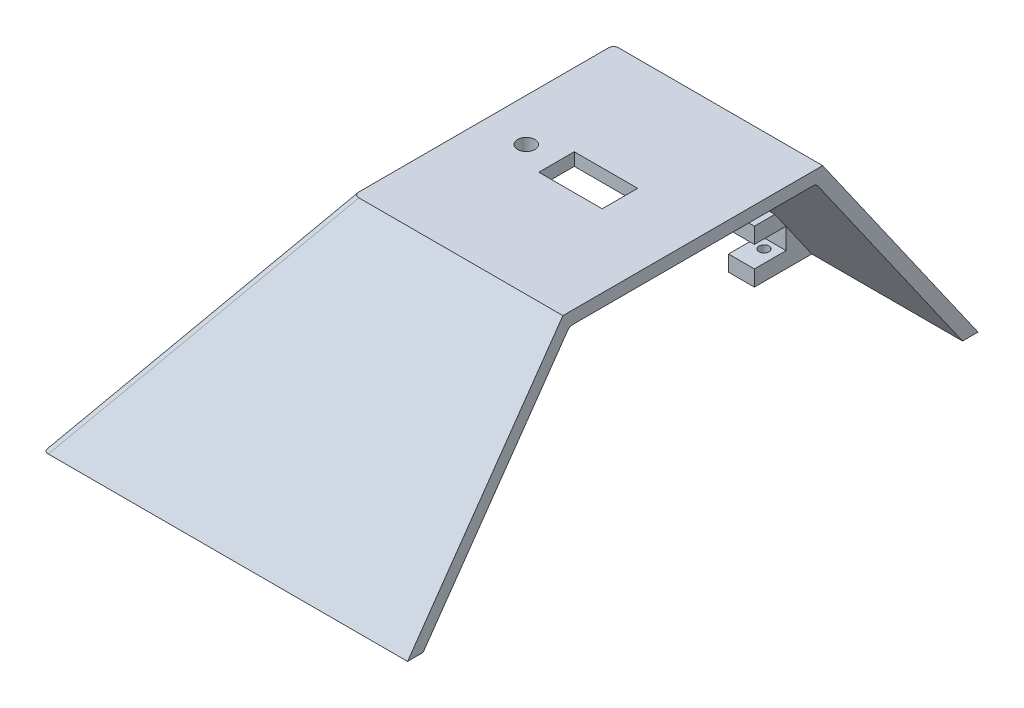
from build123d import *

# Parameters (mm, degrees)
CROQUIS1_W                        = 180
CROQUIS1_H                        = 180
SALIENTE_EXTRUIR1_DEPTH           = 70
CORTAR_EXTRUIR2_REACH             = 215.073
CORTAR_EXTRUIR1_REACH             = 215.073
VACIADO1_T                        = -4
CORTAR_EXTRUIR3_REACH             = 182.293
CORTAR_EXTRUIR5_REACH             = 147.258
CORTAR_EXTRUIR5_DIRECTION_2_REACH = 147.258
SALIENTE_EXTRUIR2_REACH           = 196.034
CROQUIS9_W                        = 8.169588688
CROQUIS9_H                        = 16.665225582
CROQUIS10_W                       = 8.169588688
CROQUIS10_H                       = 6.685330319
CORTAR_EXTRUIR6_DEPTH             = 10
CORTAR_EXTRUIR7_REACH             = 147.258
CROQUIS11_R                       = 1.585
CORTAR_EXTRUIR8_REACH             = 147.258
CROQUIS12_W                       = 20
CROQUIS12_H                       = 11.2
REDONDEO1_R                       = 2
CORTAR_EXTRUIR9_REACH             = 147.258
CROQUIS13_R                       = 2.75


with BuildPart() as part:
    # Croquis1 → Saliente-Extruir1 (new body)
    with BuildSketch(Plane(origin=(0, 0, 0), x_dir=(1, 0, 0), z_dir=(0, 1, 0))):
        Rectangle(CROQUIS1_W, CROQUIS1_H)
    extrude(amount=SALIENTE_EXTRUIR1_DEPTH)

    # Croquis3 → Cortar-Extruir2 (cut, up to next)
    with BuildSketch(Plane.ZY.offset(90), mode=Mode.PRIVATE) as cortar_extruir2_sk1:
        Polygon((-90, 0), (-90, 70), (-40.985472325, 70), align=None)
    cortar_extruir2_tool1 = extrude(cortar_extruir2_sk1.sketch, amount=-CORTAR_EXTRUIR2_REACH, mode=Mode.PRIVATE) & part.part
    # Croquis3 → Cortar-Extruir2 (cut, up to next)
    with BuildSketch(Plane.ZY.offset(90), mode=Mode.PRIVATE) as cortar_extruir2_sk2:
        Polygon((90, 0), (90, 70), (40.985472325, 70), align=None)
    cortar_extruir2_tool2 = extrude(cortar_extruir2_sk2.sketch, amount=-CORTAR_EXTRUIR2_REACH, mode=Mode.PRIVATE) & part.part
    add(cortar_extruir2_tool1.solids().sort_by_distance((-90, 46.666667, -73.661824))[0], mode=Mode.SUBTRACT)
    add(cortar_extruir2_tool2.solids().sort_by_distance((-90, 46.666667, 73.661824))[0], mode=Mode.SUBTRACT)

    # Croquis2 → Cortar-Extruir1 (cut, up to next)
    with BuildSketch(Plane.XY.offset(90), mode=Mode.PRIVATE) as cortar_extruir1_sk1:
        Polygon((90, 0), (90, 80), (33.983396943, 80), align=None)
    cortar_extruir1_tool1 = extrude(cortar_extruir1_sk1.sketch, amount=-CORTAR_EXTRUIR1_REACH, mode=Mode.PRIVATE) & part.part
    # Croquis2 → Cortar-Extruir1 (cut, up to next)
    with BuildSketch(Plane.XY.offset(90), mode=Mode.PRIVATE) as cortar_extruir1_sk2:
        Polygon((-90, 80), (-33.983396943, 80), (-90, 0), align=None)
    cortar_extruir1_tool2 = extrude(cortar_extruir1_sk2.sketch, amount=-CORTAR_EXTRUIR1_REACH, mode=Mode.PRIVATE) & part.part
    add(cortar_extruir1_tool1.solids().sort_by_distance((71.327799, 53.333333, 90))[0], mode=Mode.SUBTRACT)
    add(cortar_extruir1_tool2.solids().sort_by_distance((-71.327799, 53.333333, 90))[0], mode=Mode.SUBTRACT)

    # Vaciado1
    vaciado1_openings = [part.faces().sort_by_distance(p)[0] for p in [
        (0, 0, 0),
    ]]
    offset(amount=VACIADO1_T, openings=vaciado1_openings, kind=Kind.INTERSECTION)

    # Croquis4 → Cortar-Extruir3 (cut, up to next)
    with BuildSketch(Plane(origin=(60.39090645, 42.286167935, 0), x_dir=(0, 0, -1), z_dir=(0.819152044288995, 0.5735764363510417, 0)), mode=Mode.PRIVATE) as cortar_extruir3_sk1:
        Polygon((-90, -51.621879272), (-40.985472325, 33.832341942), (40.985472325, 33.832341942), (90, -51.621879272), align=None)
    cortar_extruir3_tool1 = extrude(cortar_extruir3_sk1.sketch, amount=-CORTAR_EXTRUIR3_REACH, mode=Mode.PRIVATE) & part.part
    add(cortar_extruir3_tool1.solids().sort_by_distance((68.549594, 30.634354, 0))[0], mode=Mode.SUBTRACT)

    # Croquis7 → Cortar-Extruir5 (cut, up to next)
    with BuildSketch(Plane.XY, mode=Mode.PRIVATE) as cortar_extruir5_sk1:
        Polygon((90, 0), (25, 0), (25, 70), (40.985472325, 70), align=None)
    cortar_extruir5_tool1 = extrude(cortar_extruir5_sk1.sketch, amount=-CORTAR_EXTRUIR5_REACH, mode=Mode.PRIVATE) & part.part
    add(cortar_extruir5_tool1.solids().sort_by_distance((47.718441, 27.939028, 0))[0], mode=Mode.SUBTRACT)

    # Croquis7 → Cortar-Extruir5 direction 2 (cut, up to next)
    with BuildSketch(Plane.XY, mode=Mode.PRIVATE) as cortar_extruir5_direction_2_sk1:
        Polygon((90, 0), (25, 0), (25, 70), (40.985472325, 70), align=None)
    cortar_extruir5_direction_2_tool1 = extrude(cortar_extruir5_direction_2_sk1.sketch, amount=CORTAR_EXTRUIR5_DIRECTION_2_REACH, mode=Mode.PRIVATE) & part.part
    add(cortar_extruir5_direction_2_tool1.solids().sort_by_distance((47.718441, 27.939028, 0))[0], mode=Mode.SUBTRACT)

    # Croquis9 → Saliente-Extruir2 (add, up to next)
    with BuildSketch(Plane.XY.offset(67), mode=Mode.PRIVATE) as saliente_extruir2_sk1:
        with Locations((-26.646600935, 8.332612791)):
            Rectangle(CROQUIS9_W, CROQUIS9_H)
    saliente_extruir2_tool1 = extrude(saliente_extruir2_sk1.sketch, amount=SALIENTE_EXTRUIR2_REACH, mode=Mode.PRIVATE) - part.part
    saliente_extruir2 = saliente_extruir2_tool1.solids().sort_by_distance((-26.646601, 8.332613, 67))[0]
    add(saliente_extruir2)

    # Croquis10 → Cortar-Extruir6 (cut)
    with BuildSketch(Plane(origin=(0, 0, 67), x_dir=(-1, 0, 0), z_dir=(0, 0, -1))):
        with Locations((26.646600935, 8.330225582)):
            Rectangle(CROQUIS10_W, CROQUIS10_H)
    cortar_extruir6 = extrude(amount=-CORTAR_EXTRUIR6_DEPTH, mode=Mode.SUBTRACT)

    # Croquis11 → Cortar-Extruir7 (cut, up to next)
    with BuildSketch(Plane.XZ, mode=Mode.PRIVATE) as cortar_extruir7_sk1:
        with Locations((-26.510403824, 74)):
            Circle(CROQUIS11_R)
    cortar_extruir7_tool1 = extrude(cortar_extruir7_sk1.sketch, amount=-CORTAR_EXTRUIR7_REACH, mode=Mode.PRIVATE) & part.part
    cortar_extruir7 = cortar_extruir7_tool1.solids().sort_by_distance((-26.510404, 0, 74))[0]
    add(cortar_extruir7, mode=Mode.SUBTRACT)

    # Simetría1: Saliente-Extruir2, Cortar-Extruir6, Cortar-Extruir7 across plane
    add(saliente_extruir2.mirror(Plane.XY))
    add(cortar_extruir6.mirror(Plane.XY), mode=Mode.SUBTRACT)
    add(cortar_extruir7.mirror(Plane.XY), mode=Mode.SUBTRACT)

    # Croquis12 → Cortar-Extruir8 (cut, up to next)
    with BuildSketch(Plane(origin=(0, 70, 0), x_dir=(1, 0, 0), z_dir=(0, 1, 0)), mode=Mode.PRIVATE) as cortar_extruir8_sk1:
        with Locations((-7.990472325, 0.000472325)):
            Rectangle(CROQUIS12_W, CROQUIS12_H)
    cortar_extruir8_tool1 = extrude(cortar_extruir8_sk1.sketch, amount=-CORTAR_EXTRUIR8_REACH, mode=Mode.PRIVATE) & part.part
    add(cortar_extruir8_tool1.solids().sort_by_distance((-7.990472, 70, -0.000472))[0], mode=Mode.SUBTRACT)

    # Redondeo1
    redondeo1_edges = [part.edges().sort_by_distance(p)[0] for p in [
        (-6.951602062, 66, -38.903204123),
        (-6.951602062, 66, 38.903204123),
        (-65.492736163, 35, 65.492736163),
        (-38.903204123, 66, 0),
        (-62.010052884, 33, -62.010052884),
        (-65.492736163, 35, -65.492736163),
        (-62.010052884, 33, 62.010052884),
    ]]
    fillet(redondeo1_edges, radius=REDONDEO1_R)

    # Croquis13 → Cortar-Extruir9 (cut, up to next)
    with BuildSketch(Plane(origin=(0, 70, 0), x_dir=(1, 0, 0), z_dir=(0, 1, 0)), mode=Mode.PRIVATE) as cortar_extruir9_sk1:
        with Locations((-27.546576138, 0)):
            Circle(CROQUIS13_R)
    cortar_extruir9_tool1 = extrude(cortar_extruir9_sk1.sketch, amount=-CORTAR_EXTRUIR9_REACH, mode=Mode.PRIVATE) & part.part
    add(cortar_extruir9_tool1.solids().sort_by_distance((-27.546576, 70, 0))[0], mode=Mode.SUBTRACT)


solid = part.part
